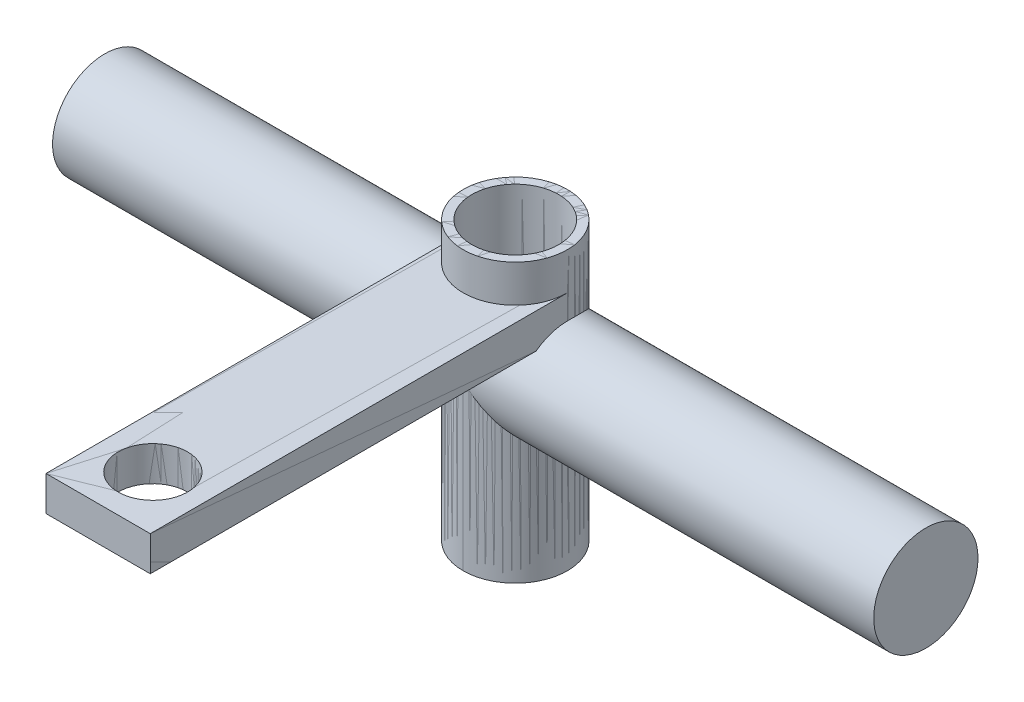
from build123d import *

# Parameters (mm, degrees)
SKETCH1_R          = 9.525
SLEEVE_DEPTH       = 50.8
SKETCH2_W          = 19.05
SKETCH2_H          = 6.35
BRACKET_DEPTH      = 76.2
SKETCH4_R          = 6.35
BRACKET_HOLE_DEPTH = 93.075
SKETCH5_R          = 9.525
SHAFT_DEPTH        = 75
SKETCH6_R          = 7.9375
SLEEVE_HOLE_DEPTH  = 119.372631972


with BuildPart() as part:
    # Sketch1 → Sleeve (new body)
    with BuildSketch(Plane(origin=(0, 0, 0), x_dir=(1, 0, 0), z_dir=(0, 1, 0))):
        Circle(SKETCH1_R)
    extrude(amount=SLEEVE_DEPTH)

    # Sketch2 → Bracket (add)
    with BuildSketch(Plane.XY):
        with Locations((0, 40.8)):
            Rectangle(SKETCH2_W, SKETCH2_H)
    extrude(amount=BRACKET_DEPTH)

    # Sketch4 → Bracket Hole (cut, through all)
    with BuildSketch(Plane(origin=(0, 0, 0), x_dir=(1, 0, 0), z_dir=(0, 1, 0))):
        with Locations((0, -66.2)):
            Circle(SKETCH4_R)
    extrude(amount=BRACKET_HOLE_DEPTH, mode=Mode.SUBTRACT)

    # Sketch5 → Shaft (add)
    with BuildSketch(Plane(origin=(0, 0, 0), x_dir=(0, 0, -1), z_dir=(1, 0, 0))):
        with Locations((0, 30)):
            Circle(SKETCH5_R)
    extrude(amount=SHAFT_DEPTH)

    # Sketch6 → Sleeve Hole (cut, through all)
    with BuildSketch(Plane(origin=(0, 0, 0), x_dir=(1, 0, 0), z_dir=(0, 1, 0))):
        Circle(SKETCH6_R)
    extrude(amount=SLEEVE_HOLE_DEPTH, mode=Mode.SUBTRACT)


with BuildPart() as body_2:
    # Mirror1: mirrored copy
    add(part.part.mirror(Plane(origin=(0, 0, 0), x_dir=(0, 0, 1), z_dir=(1, 0, 0))))


solid = Compound([part.part, body_2.part])
